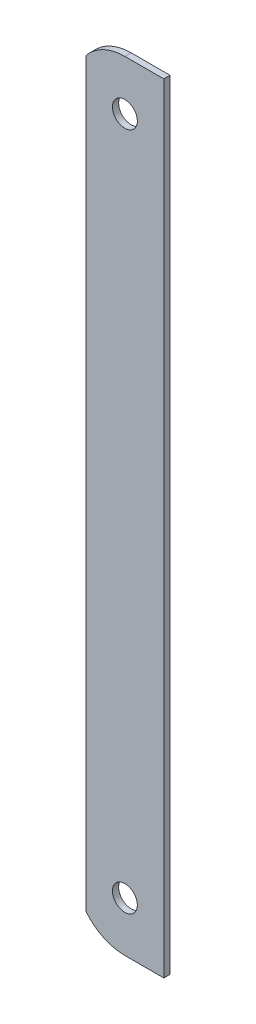
from build123d import *

# Parameters (mm, degrees)
SKETCH1_R           = 4
BOSS_EXTRUDE1_DEPTH = 2


with BuildPart() as part:
    # Sketch1 → Boss-Extrude1 (new body)
    with BuildSketch(Plane.XY):
        with BuildLine():
            Line((3.5, 125), (12.5, 125))
            Line((12.5, 125), (12.5, -125))
            Line((12.5, -125), (3.5, -125))
            Line((3.5, -125), (0, -125))
            ThreePointArc((0, -125), (-6.935420865, -123.418735639), (-12.5, -118.987492178))
            Line((-12.5, -118.987492178), (-12.5, -109))
            Line((-12.5, -109), (-12.5, 109))
            Line((-12.5, 109), (-12.5, 118.987492178))
            ThreePointArc((-12.5, 118.987492178), (-6.935420865, 123.418735639), (0, 125))
            Line((0, 125), (3.5, 125))
        make_face()
        with Locations((0, 109)):
            Circle(SKETCH1_R, mode=Mode.SUBTRACT)
        with Locations((0, -109)):
            Circle(SKETCH1_R, mode=Mode.SUBTRACT)
    extrude(amount=BOSS_EXTRUDE1_DEPTH)


solid = part.part
